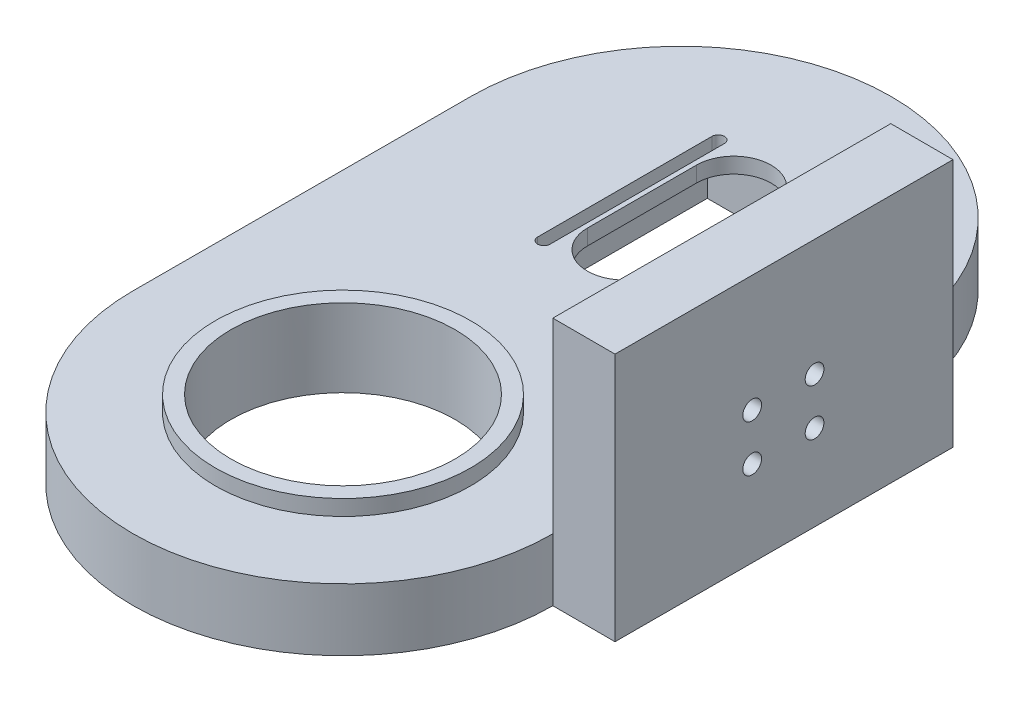
from build123d import *

# Parameters (mm, degrees)
BOSS_EXTRUDE1_DEPTH = 20
SKETCH8_W           = 42
SKETCH8_H           = 60
CUT_EXTRUDE1_DEPTH  = 15
CUT_EXTRUDE2_START  = -5
CUT_EXTRUDE2_DEPTH  = 5
SKETCH10_R          = 36
CUT_EXTRUDE3_DEPTH  = 159.272933389
SKETCH11_R          = 41
SKETCH11_R_2        = 36
BOSS_EXTRUDE4_DEPTH = 5
SKETCH2_W           = 108.361469825
SKETCH2_H           = 80
SKETCH2_R           = 3
BOSS_EXTRUDE6_DEPTH = 20


# Read off the part's stored shape, not the designer's step: Cut-Extrude2
with BuildPart() as part:
    # Sketch1 → Boss-Extrude1 (new body)
    with BuildSketch(Plane(origin=(0, 0, 0), x_dir=(1, 0, 0), z_dir=(0, 1, 0))):
        with BuildLine():
            Line((47.685345344, 62.745795153), (47.499901156, -45.615515992))
            ThreePointArc((47.499901156, -45.615515992), (-20.115515992, -112.999901156), (-87.499901156, -45.384484008))
            Line((-87.499901156, -45.384484008), (-87.314456968, 62.976827137))
            ThreePointArc((-87.314456968, 62.976827137), (-19.69903982, 130.361212301), (47.685345344, 62.745795153))
        make_face()
    extrude(amount=BOSS_EXTRUDE1_DEPTH)

    # Sketch8 → Cut-Extrude1 (cut)
    with BuildSketch(Plane.XZ):
        with Locations((-20, -62.5)):
            Rectangle(SKETCH8_W, SKETCH8_H)
    extrude(amount=-CUT_EXTRUDE1_DEPTH, mode=Mode.SUBTRACT)

    # Cut-Extrude2 outline → Cut-Extrude2 (cut)
    with BuildSketch(Plane.XZ.offset(-15).offset(CUT_EXTRUDE2_START)):
        with BuildLine():
            Line((-6.5, -34.5), (-6.5, -90.5))
            ThreePointArc((-6.5, -90.5), (-4.5, -92.5), (-2.5, -90.5))
            Line((-2.5, -90.5), (-2.5, -34.5))
            ThreePointArc((-2.5, -34.5), (-4.5, -32.5), (-6.5, -34.5))
        make_face()
        with BuildLine():
            ThreePointArc((-8, -45), (-20, -33), (-32, -45))
            Line((-32, -45), (-32, -80))
            ThreePointArc((-32, -80), (-20, -92), (-8, -80))
            Line((-8, -80), (-8, -45))
        make_face()
        with BuildLine():
            Line((-37.5, -34.5), (-37.5, -90.5))
            ThreePointArc((-37.5, -90.5), (-35.5, -92.5), (-33.5, -90.5))
            Line((-33.5, -90.5), (-33.5, -34.5))
            ThreePointArc((-33.5, -34.5), (-35.5, -32.5), (-37.5, -34.5))
        make_face()
    extrude(amount=CUT_EXTRUDE2_DEPTH, mode=Mode.SUBTRACT)

    # Sketch10 → Cut-Extrude3 (cut, through all)
    with BuildSketch(Plane.XZ):
        with Locations(Location((-20, 45.5, 0), (0, 0, 270))):
            Circle(SKETCH10_R)
    extrude(amount=-CUT_EXTRUDE3_DEPTH, mode=Mode.SUBTRACT)

    # Sketch11 → Boss-Extrude4 (add)
    with BuildSketch(Plane(origin=(0, 20, 0), x_dir=(1, 0, 0), z_dir=(0, 1, 0))):
        with Locations(Location((-20, -45.5, 0), (0, 0, 270))):
            Circle(SKETCH11_R)
        with Locations(Location((-20, -45.5, 0), (0, 0, 90))):
            Circle(SKETCH11_R_2, mode=Mode.SUBTRACT)
    extrude(amount=BOSS_EXTRUDE4_DEPTH)

    # Sketch2 → Boss-Extrude6 (add)
    with BuildSketch(Plane(origin=(47.577825951, 0, 0.081422338), x_dir=(0.0017113480294572096, 0, -0.9999985356428889), z_dir=(0.999998535642889, 0, 0.0017113480294572096))):
        with Locations((8.64657458, 40)):
            Rectangle(SKETCH2_W, SKETCH2_H)
        with Locations((-1.551375347, 27.5)):
            Circle(SKETCH2_R, mode=Mode.SUBTRACT)
        with Locations((18.448624653, 27.5)):
            Circle(SKETCH2_R, mode=Mode.SUBTRACT)
        with Locations((18.448624653, 42.5)):
            Circle(SKETCH2_R, mode=Mode.SUBTRACT)
        with Locations((-1.551375347, 42.5)):
            Circle(SKETCH2_R, mode=Mode.SUBTRACT)
    extrude(amount=BOSS_EXTRUDE6_DEPTH)


solid = part.part
